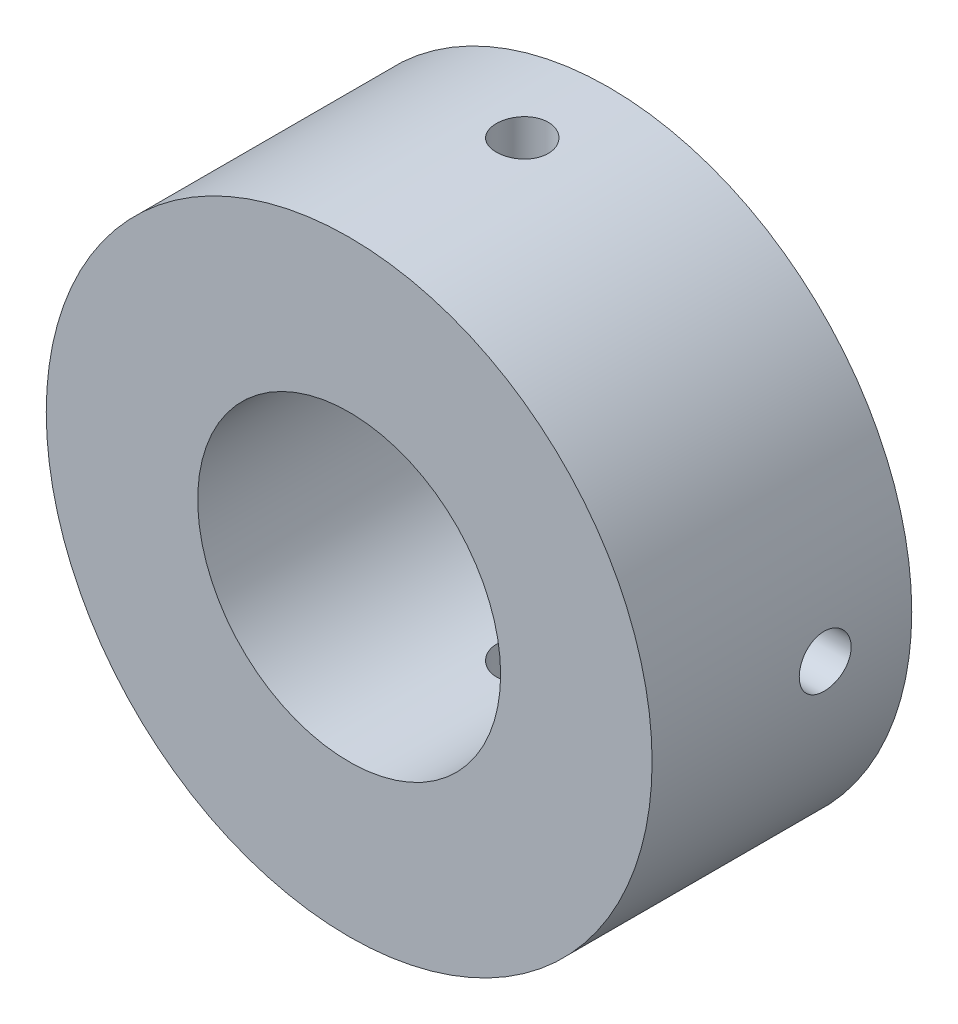
from build123d import *

# Parameters (mm, degrees)
BOSS_EXTRUDE1_DEPTH      = 10
BOSS_EXTRUDE1_DEPTH_BACK = 5
SKETCH1_R                = 17.5
SKETCH1_R_2              = 8.75
CUT_EXTRUDE1_DEPTH       = 27.69269563
CUT_EXTRUDE1_DEPTH_BACK  = 27.69269563
SKETCH2_R                = 1.5
SKETCH3_R                = 1.5
CUT_EXTRUDE2_DEPTH       = 27.692695815


with BuildPart() as part:
    # Sketch1 → Boss-Extrude1 (new, two sides: drawn at the far end of the back side and taken through both)
    with BuildSketch(Plane.XY.offset(-BOSS_EXTRUDE1_DEPTH_BACK)):
        Circle(SKETCH1_R)
        Circle(SKETCH1_R_2, mode=Mode.SUBTRACT)
    extrude(amount=BOSS_EXTRUDE1_DEPTH + BOSS_EXTRUDE1_DEPTH_BACK)

    # Sketch2 → Cut-Extrude1 (cut, two sides: drawn at the far end of the back side and taken through both)
    with BuildSketch(Plane(origin=(0, 0, 0), x_dir=(1, 0, 0), z_dir=(0, 1, 0)).offset(-CUT_EXTRUDE1_DEPTH_BACK)):
        Circle(SKETCH2_R)
    extrude(amount=CUT_EXTRUDE1_DEPTH + CUT_EXTRUDE1_DEPTH_BACK, mode=Mode.SUBTRACT)

    # Sketch3 → Cut-Extrude2 (cut, through all)
    with BuildSketch(Plane(origin=(0, 0, 0), x_dir=(0, 0, -1), z_dir=(1, 0, 0))):
        Circle(SKETCH3_R)
    extrude(amount=CUT_EXTRUDE2_DEPTH, mode=Mode.SUBTRACT)


solid = part.part
